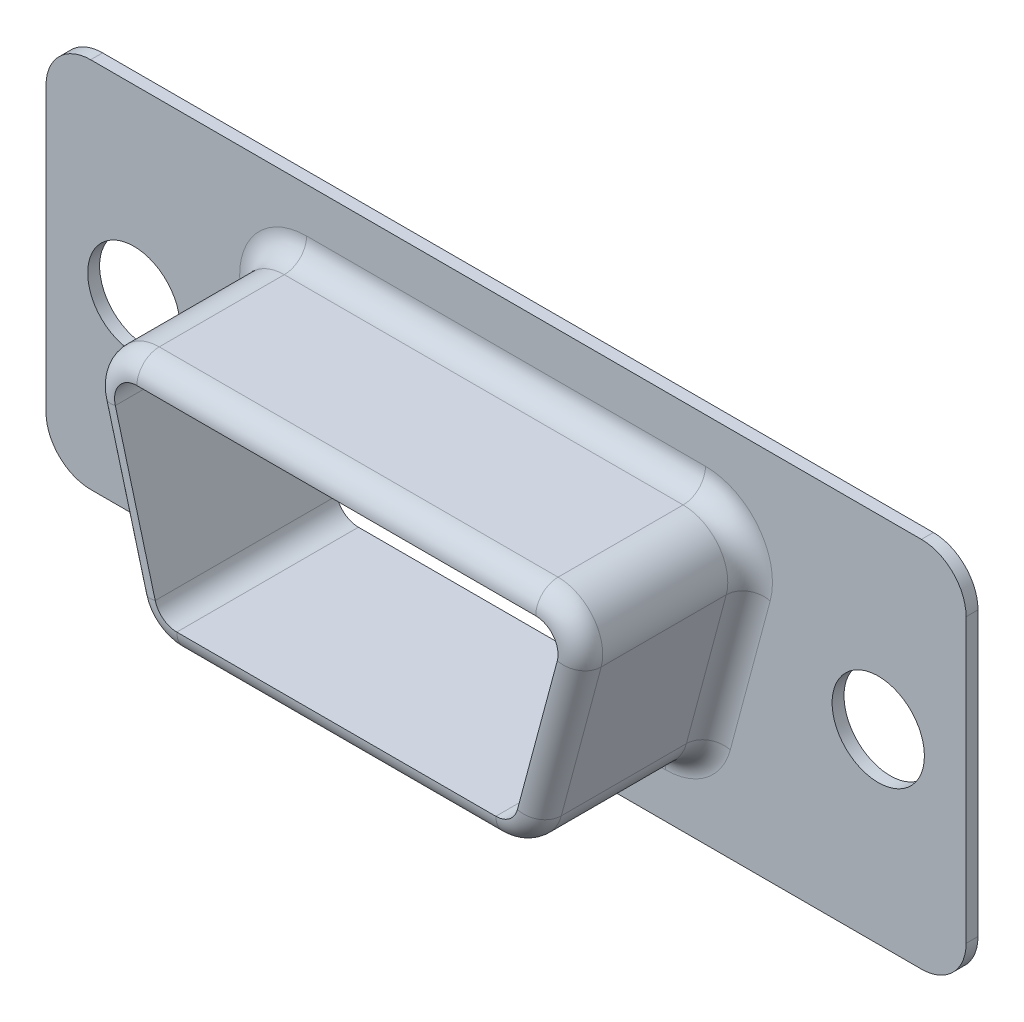
from build123d import *

# Parameters (mm, degrees)
SKETCH1_R           = 1.55
BOSS_EXTRUDE1_DEPTH = 0.4
BOSS_EXTRUDE2_DEPTH = 5.7
FILLET1_R           = 0.75


with BuildPart() as part:
    # Sketch1 → Boss-Extrude1 (new body)
    with BuildSketch(Plane.XY):
        with BuildLine():
            Line((-13.95, 6.25), (13.95, 6.25))
            ThreePointArc((13.95, 6.25), (15.010660172, 5.810660172), (15.45, 4.75))
            Line((15.45, 4.75), (15.45, -4.75))
            ThreePointArc((15.45, -4.75), (15.010660172, -5.810660172), (13.95, -6.25))
            Line((13.95, -6.25), (-13.95, -6.25))
            ThreePointArc((-13.95, -6.25), (-15.010660172, -5.810660172), (-15.45, -4.75))
            Line((-15.45, -4.75), (-15.45, 4.75))
            ThreePointArc((-15.45, 4.75), (-15.010660172, 5.810660172), (-13.95, 6.25))
        make_face()
        with Locations((-12.5, 0)):
            Circle(SKETCH1_R, mode=Mode.SUBTRACT)
        with Locations((12.5, 0)):
            Circle(SKETCH1_R, mode=Mode.SUBTRACT)
        with BuildLine():
            Line((-6.697085729, 3.25), (6.697085729, 3.25))
            ThreePointArc((6.697085729, 3.25), (7.292100735, 2.956571072), (7.421530099, 2.305885716))
            Line((7.421530099, 2.305885716), (6.081784137, -2.694114284))
            ThreePointArc((6.081784137, -2.694114284), (5.813910839, -3.095015005), (5.357339767, -3.25))
            Line((5.357339767, -3.25), (-5.357339767, -3.25))
            ThreePointArc((-5.357339767, -3.25), (-5.813910839, -3.095015005), (-6.081784137, -2.694114284))
            Line((-6.081784137, -2.694114284), (-7.421530099, 2.305885716))
            ThreePointArc((-7.421530099, 2.305885716), (-7.292100735, 2.956571072), (-6.697085729, 3.25))
        make_face(mode=Mode.SUBTRACT)
    extrude(amount=BOSS_EXTRUDE1_DEPTH)

    # Sketch2 → Boss-Extrude2 (add)
    with BuildSketch(Plane.XY.offset(0.4)):
        with BuildLine():
            Line((6.697085729, 4), (-6.697085729, 4))
            ThreePointArc((-6.697085729, 4), (-7.88711574, 3.413142144), (-8.145974469, 2.111771432))
            Line((-8.145974469, 2.111771432), (-6.806228507, -2.888228568))
            ThreePointArc((-6.806228507, -2.888228568), (-6.270481911, -3.69003001), (-5.357339767, -4))
            Line((-5.357339767, -4), (5.357339767, -4))
            ThreePointArc((5.357339767, -4), (6.270481911, -3.69003001), (6.806228507, -2.888228568))
            Line((6.806228507, -2.888228568), (8.145974469, 2.111771432))
            ThreePointArc((8.145974469, 2.111771432), (7.88711574, 3.413142144), (6.697085729, 4))
        make_face()
        with BuildLine():
            Line((-7.421530099, 2.305885716), (-6.081784137, -2.694114284))
            ThreePointArc((-6.081784137, -2.694114284), (-5.813910839, -3.095015005), (-5.357339767, -3.25))
            Line((-5.357339767, -3.25), (5.357339767, -3.25))
            ThreePointArc((5.357339767, -3.25), (5.813910839, -3.095015005), (6.081784137, -2.694114284))
            Line((6.081784137, -2.694114284), (7.421530099, 2.305885716))
            ThreePointArc((7.421530099, 2.305885716), (7.292100735, 2.956571072), (6.697085729, 3.25))
            Line((6.697085729, 3.25), (-6.697085729, 3.25))
            ThreePointArc((-6.697085729, 3.25), (-7.292100735, 2.956571072), (-7.421530099, 2.305885716))
        make_face(mode=Mode.SUBTRACT)
    extrude(amount=BOSS_EXTRUDE2_DEPTH)

    # Fillet1
    fillet1_edges = [part.edges().sort_by_distance(p)[0] for p in [
        (-6.270481911, -3.69003001, 6.1),
        (0, -4, 6.1),
        (6.270481911, -3.69003001, 6.1),
        (7.476101488, -0.388228568, 6.1),
        (7.88711574, 3.413142144, 6.1),
        (0, 4, 6.1),
        (-7.88711574, 3.413142144, 6.1),
        (-7.476101488, -0.388228568, 6.1),
        (-6.270481911, -3.69003001, 0.4),
        (0, -4, 0.4),
        (6.270481911, -3.69003001, 0.4),
        (7.476101488, -0.388228568, 0.4),
        (7.88711574, 3.413142144, 0.4),
        (0, 4, 0.4),
        (-7.88711574, 3.413142144, 0.4),
        (-7.476101488, -0.388228568, 0.4),
    ]]
    fillet(fillet1_edges, radius=FILLET1_R - 0.0001)  # a hair under: the kernel refuses the full size


solid = part.part
